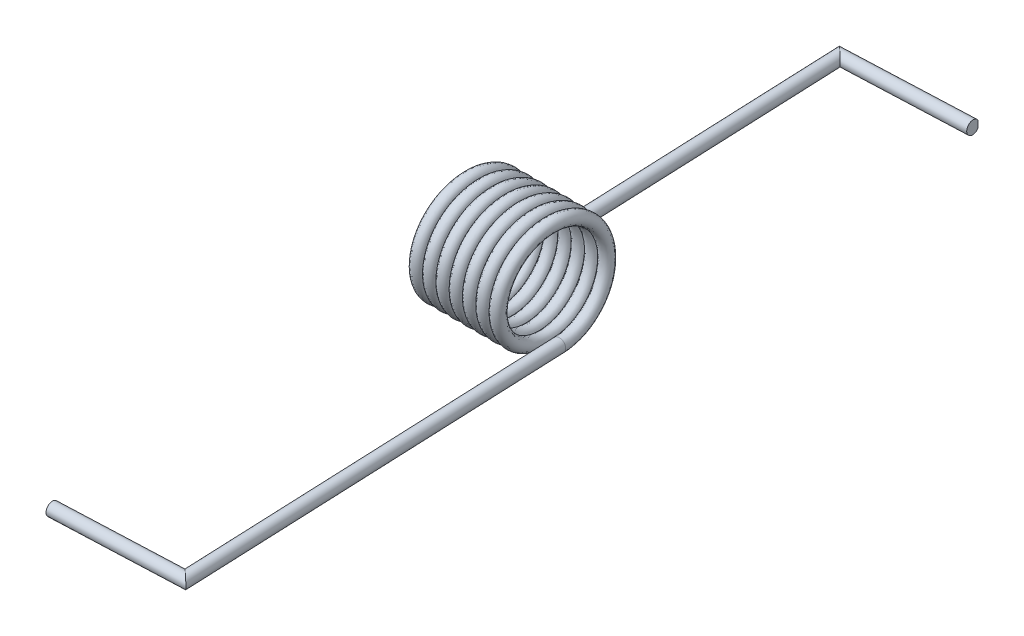
from build123d import *
from build123d.topology import SkipClean

# Parameters (mm, degrees)
SWEEP1_PITCH            = 0.6604
SWEEP1_HEIGHT           = 4.6228
SWEEP1_RADIUS           = 2.5273
SWEEP1_START_ANGLE      = 90
SKETCH2_R               = 0.3175
SKETCH3_R               = 0.3175
EXTRUDE1_DEPTH          = 19.05
SKETCH4_R               = 0.3175
EXTRUDE2_DEPTH          = 19.05
SKETCH7_W               = 6.35
SKETCH7_H               = 0.635
BOSS_EXTRUDE1_DEPTH     = 0.635
CUT_EXTRUDE2_REACH      = 23.224
CUT_EXTRUDE2_END_RADIUS = 0.3175
CUT_EXTRUDE3_DEPTH      = 22.224395539
BOSS_EXTRUDE2_DEPTH     = 0.635
CUT_EXTRUDE4_DEPTH      = 0.635
CUT_EXTRUDE5_DEPTH      = 0.635
SKETCH13_W              = 6.35
SKETCH13_H              = 0.635
BOSS_EXTRUDE3_DEPTH     = 0.635
CUT_EXTRUDE7_REACH      = 23.539
CUT_EXTRUDE7_END_RADIUS = 0.3175
CUT_EXTRUDE8_DEPTH      = 22.538697441
BOSS_EXTRUDE4_DEPTH     = 2.54
CUT_EXTRUDE9_DEPTH      = 2.54
CUT_EXTRUDE10_DEPTH     = 1


with BuildPart() as part:
    # Sweep1: sweep along a helix
    with BuildLine() as sweep1_path:
        add(Helix(SWEEP1_PITCH, SWEEP1_HEIGHT, SWEEP1_RADIUS, center=(0, 0, 0), direction=(-1, 0, 0), lefthand=True, mode=Mode.PRIVATE).rotate(Axis((0, 0, 0), (-1, 0, 0)), SWEEP1_START_ANGLE))
    # Sketch2 → Sweep1 (sweep)
    with BuildSketch(Plane(origin=(0, -2.5273, 0), x_dir=(-0.999136329894069, 2.592021800397213e-14, 0.04155230782772583), z_dir=(-0.04155230782772583, 9.227561234821615e-15, -0.999136329894069))):
        Circle(SKETCH2_R)
    sweep(path=sweep1_path.line, is_frenet=True)

    # Sketch3 → Extrude1 (add)
    with BuildSketch(Plane(origin=(0, 0, 0), x_dir=(0.999136329894069, -2.5892465091430287e-14, -0.04155230782772583), z_dir=(0.04155230782772583, -9.227561234821617e-15, 0.999136329894069))):
        with Locations(Location((0, -2.5273, 0), (0, 0, 180))):
            Circle(SKETCH3_R)
    extrude(amount=EXTRUDE1_DEPTH)

    # Sketch4 → Extrude2 (add)
    with BuildSketch(Plane(origin=(-0.0079817, 0, -0.191922108), x_dir=(-0.9954688080488999, -0.08560321398082571, 0.041399782099129125), z_dir=(-0.04155230782772583, 1.0690363524967772e-13, -0.9991363298940691))):
        with Locations(Location((4.818198209, -2.122638299, 0), (0, 0, 4.910712917))):
            Circle(SKETCH4_R)
    extrude(amount=EXTRUDE2_DEPTH)

    # Sketch7 → Boss-Extrude1 (add)
    with BuildSketch(Plane(origin=(0.791571464, 0, 19.033547084), x_dir=(0.999136329894069, 0, -0.04155230782772582), z_dir=(0.04155230782772582, -9.227561234821609e-15, 0.999136329894069))):
        with Locations((-3.175, -2.5273)):
            Rectangle(SKETCH7_W, SKETCH7_H)
    extrude(amount=BOSS_EXTRUDE1_DEPTH)

    # Cut-Extrude2: up to this cylinder (the profile starts outside it)
    cut_extrude2_end = Plane(origin=(0.794518313, -2.5273, 19.104404861), z_dir=(-0.04155230782772583, 9.227561234821617e-15, -0.999136329894069)) * Cylinder(CUT_EXTRUDE2_END_RADIUS, 48.083, mode=Mode.PRIVATE)
    # Sketch8 → Cut-Extrude2 (cut, up to the surface)
    with BuildSketch(Plane(origin=(-6.344515695, 0, 0.263857155), x_dir=(0.04155230782772582, 0, 0.999136329894069), z_dir=(-0.999136329894069, 0, 0.04155230782772582)), mode=Mode.PRIVATE) as cut_extrude2_sk1:
        with BuildLine():
            Line((19.3675, -2.2098), (19.05, -2.2098))
            Line((19.05, -2.2098), (19.05, -2.5273))
            ThreePointArc((19.05, -2.5273), (19.142993597, -2.302793597), (19.3675, -2.2098))
        make_face()
    cut_extrude2_tool1 = extrude(cut_extrude2_sk1.sketch, amount=-CUT_EXTRUDE2_REACH, mode=Mode.PRIVATE) - cut_extrude2_end
    add(cut_extrude2_tool1.solids().sort_by_distance((-5.549997, -2.280719, 19.368262))[0], mode=Mode.SUBTRACT)
    # Sketch8 → Cut-Extrude2 (cut, up to the surface)
    with BuildSketch(Plane(origin=(-6.344515695, 0, 0.263857155), x_dir=(0.04155230782772582, 0, 0.999136329894069), z_dir=(-0.999136329894069, 0, 0.04155230782772582)), mode=Mode.PRIVATE) as cut_extrude2_sk2:
        with BuildLine():
            ThreePointArc((19.3675, -2.8448), (19.142993597, -2.751806403), (19.05, -2.5273))
            Line((19.05, -2.5273), (19.05, -2.8448))
            Line((19.05, -2.8448), (19.3675, -2.8448))
        make_face()
    cut_extrude2_tool2 = extrude(cut_extrude2_sk2.sketch, amount=-CUT_EXTRUDE2_REACH, mode=Mode.PRIVATE) - cut_extrude2_end
    add(cut_extrude2_tool2.solids().sort_by_distance((-5.549997, -2.773881, 19.368262))[0], mode=Mode.SUBTRACT)

    # Sketch9 → Cut-Extrude3 (cut, through all)
    with BuildSketch(Plane(origin=(-6.344515695, 0, 0.263857155), x_dir=(0.04155230782772582, 0, 0.999136329894069), z_dir=(-0.999136329894069, 0, 0.04155230782772582))):
        with BuildLine():
            Line((19.685, -2.2098), (19.3675, -2.2098))
            ThreePointArc((19.3675, -2.2098), (19.592006403, -2.302793597), (19.685, -2.5273))
            Line((19.685, -2.5273), (19.685, -2.2098))
        make_face()
        with BuildLine():
            ThreePointArc((19.685, -2.5273), (19.592006403, -2.751806403), (19.3675, -2.8448))
            Line((19.3675, -2.8448), (19.685, -2.8448))
            Line((19.685, -2.8448), (19.685, -2.5273))
        make_face()
    extrude(amount=-CUT_EXTRUDE3_DEPTH, mode=Mode.SUBTRACT)

    # Sketch10 → Boss-Extrude2 (add)
    with BuildSketch(Plane(origin=(0.791571464, 0, 19.033547084), x_dir=(0.999136329894069, 0, -0.04155230782772582), z_dir=(0.04155230782772582, -9.227561234821609e-15, 0.999136329894069))):
        with BuildLine():
            ThreePointArc((0, -2.8448), (0.3175, -2.5273), (0, -2.2098))
            Line((0, -2.2098), (0, -2.8448))
        make_face()
    extrude(amount=BOSS_EXTRUDE2_DEPTH)

    # Sketch11 → Cut-Extrude4 (cut)
    with BuildSketch(Plane(origin=(0, 0, 0), x_dir=(0.04155230782772582, 0, 0.999136329894069), z_dir=(-0.999136329894069, 0, 0.04155230782772582))):
        with BuildLine():
            Line((19.685, -2.5273), (19.685, -2.2098))
            Line((19.685, -2.2098), (19.3675, -2.2098))
            ThreePointArc((19.3675, -2.2098), (19.592006403, -2.302793597), (19.685, -2.5273))
        make_face()
    extrude(amount=-CUT_EXTRUDE4_DEPTH, mode=Mode.SUBTRACT)

    # Sketch12 → Cut-Extrude5 (cut)
    with SkipClean():  # the faces are left unmerged after this step: merging them gives an invalid solid
        with BuildSketch(Plane(origin=(0, 0, 0), x_dir=(0.04155230782772582, 0, 0.999136329894069), z_dir=(-0.999136329894069, 0, 0.04155230782772582))):
            with BuildLine():
                Line((19.685, -2.5273), (19.685, -2.8448))
                Line((19.685, -2.8448), (19.3675, -2.8448))
                ThreePointArc((19.3675, -2.8448), (19.592006403, -2.751806403), (19.685, -2.5273))
            make_face()
        extrude(amount=-CUT_EXTRUDE5_DEPTH, mode=Mode.SUBTRACT)

    # Sketch13 → Boss-Extrude3 (add)
    with SkipClean():  # the faces are left unmerged after this step: merging them gives an invalid solid
        with BuildSketch(Plane(origin=(-0.799553164, 0, -19.225469192), x_dir=(-0.999136329894069, -4.445965506921285e-15, 0.04155230782772583), z_dir=(-0.04155230782772583, 1.0690442701372509e-13, -0.999136329894069))):
            with Locations((1.443807426, -2.5273)):
                Rectangle(SKETCH13_W, SKETCH13_H)
        extrude(amount=BOSS_EXTRUDE3_DEPTH)

    # Cut-Extrude7: up to this cylinder (the profile starts outside it)
    with SkipClean():  # the faces are left unmerged after this step: merging them gives an invalid solid
        cut_extrude7_end = Plane(origin=(-5.417318313, -2.5273, -19.104404861), z_dir=(0.04155230782772583, -1.0690363524967772e-13, 0.999136329894069)) * Cylinder(CUT_EXTRUDE7_END_RADIUS, 48.713, mode=Mode.PRIVATE)
        # Sketch16 → Cut-Extrude7 (cut, up to the surface)
        with BuildSketch(Plane(origin=(1.729697395, 0, -0.071935047), x_dir=(-0.04155230782772582, 0, -0.999136329894069), z_dir=(0.999136329894069, 5.2229556954063335e-15, -0.04155230782772582)), mode=Mode.PRIVATE) as cut_extrude7_sk1:
            with BuildLine():
                Line((19.559588009, -2.2098), (19.242088009, -2.2098))
                Line((19.242088009, -2.2098), (19.242088009, -2.527300006))
                ThreePointArc((19.242088009, -2.527300006), (19.335081603, -2.302793599), (19.559588009, -2.2098))
            make_face()
        cut_extrude7_tool1 = extrude(cut_extrude7_sk1.sketch, amount=-CUT_EXTRUDE7_REACH, mode=Mode.PRIVATE) - cut_extrude7_end
        add(cut_extrude7_tool1.solids().sort_by_distance((0.927197, -2.280719, -19.368262))[0], mode=Mode.SUBTRACT)
        # Sketch16 → Cut-Extrude7 (cut, up to the surface)
        with BuildSketch(Plane(origin=(1.729697395, 0, -0.071935047), x_dir=(-0.04155230782772582, 0, -0.999136329894069), z_dir=(0.999136329894069, 5.2229556954063335e-15, -0.04155230782772582)), mode=Mode.PRIVATE) as cut_extrude7_sk2:
            with BuildLine():
                ThreePointArc((19.559588009, -2.8448), (19.335081608, -2.751806405), (19.242088009, -2.527300006))
                Line((19.242088009, -2.527300006), (19.242088009, -2.8448))
                Line((19.242088009, -2.8448), (19.559588009, -2.8448))
            make_face()
        cut_extrude7_tool2 = extrude(cut_extrude7_sk2.sketch, amount=-CUT_EXTRUDE7_REACH, mode=Mode.PRIVATE) - cut_extrude7_end
        add(cut_extrude7_tool2.solids().sort_by_distance((0.927197, -2.773881, -19.368262))[0], mode=Mode.SUBTRACT)

    # Sketch16<4> → Cut-Extrude8 (cut, through all)
    with SkipClean():  # the faces are left unmerged after this step: merging them gives an invalid solid
        with BuildSketch(Plane(origin=(1.729697395, 0, -0.071935047), x_dir=(-0.04155230782772582, 0, -0.999136329894069), z_dir=(0.999136329894069, 5.2229556954063335e-15, -0.04155230782772582))):
            with BuildLine():
                Line((19.877088009, -2.2098), (19.559588009, -2.2098))
                ThreePointArc((19.559588009, -2.2098), (19.784094412, -2.302793597), (19.877088009, -2.5273))
                Line((19.877088009, -2.5273), (19.877088009, -2.2098))
            make_face()
            with BuildLine():
                Line((19.877088009, -2.8448), (19.877088009, -2.5273))
                ThreePointArc((19.877088009, -2.5273), (19.784094412, -2.751806403), (19.559588009, -2.8448))
                Line((19.559588009, -2.8448), (19.877088009, -2.8448))
            make_face()
        extrude(amount=-CUT_EXTRUDE8_DEPTH, mode=Mode.SUBTRACT)

    # Sketch17 → Boss-Extrude4 (add)
    with SkipClean():  # the faces are left unmerged after this step: merging them gives an invalid solid
        with BuildSketch(Plane(origin=(-0.799553164, 0, -19.225469192), x_dir=(-0.999136329894069, -4.445965506921285e-15, 0.04155230782772583), z_dir=(-0.04155230782772583, 1.0690442701372509e-13, -0.999136329894069))):
            with BuildLine():
                Line((4.618807426, -2.2098), (4.618807426, -2.8448))
                ThreePointArc((4.618807426, -2.8448), (4.936307426, -2.5273), (4.618807426, -2.2098))
            make_face()
        extrude(amount=BOSS_EXTRUDE4_DEPTH)

    # Sketch18 → Cut-Extrude9 (cut)
    with SkipClean():  # the faces are left unmerged after this step: merging them gives an invalid solid
        with BuildSketch(Plane(origin=(-4.6148183, 0, 0.191922108), x_dir=(-0.04155230782772583, 0, -0.999136329894069), z_dir=(0.999136329894069, 3.175839261742632e-15, -0.04155230782772583))):
            with BuildLine():
                Line((19.559588009, -2.8448), (21.782088009, -2.8448))
                Line((21.782088009, -2.8448), (21.782088009, -2.2098))
                Line((21.782088009, -2.2098), (19.559588009, -2.2098))
                ThreePointArc((19.559588009, -2.2098), (19.877088009, -2.5273), (19.559588009, -2.8448))
            make_face()
        extrude(amount=-CUT_EXTRUDE9_DEPTH, mode=Mode.SUBTRACT)

    # Sketch19 → Cut-Extrude10 (cut)
    with SkipClean():  # the faces are left unmerged after this step: merging them gives an invalid solid
        with BuildSketch(Plane(origin=(1.729697395, 0, -0.071935047), x_dir=(-0.04155230782772582, 0, -0.999136329894069), z_dir=(0.999136329894069, 5.2229556954063375e-15, -0.04155230782772582))):
            Polygon((19.826582005, -2.355484821), (19.826582005, -2.699115179), (19.95139975, -2.767372121), (20.024794799, -2.343292194), align=None)
        extrude(amount=-CUT_EXTRUDE10_DEPTH, mode=Mode.SUBTRACT)


solid = part.part
